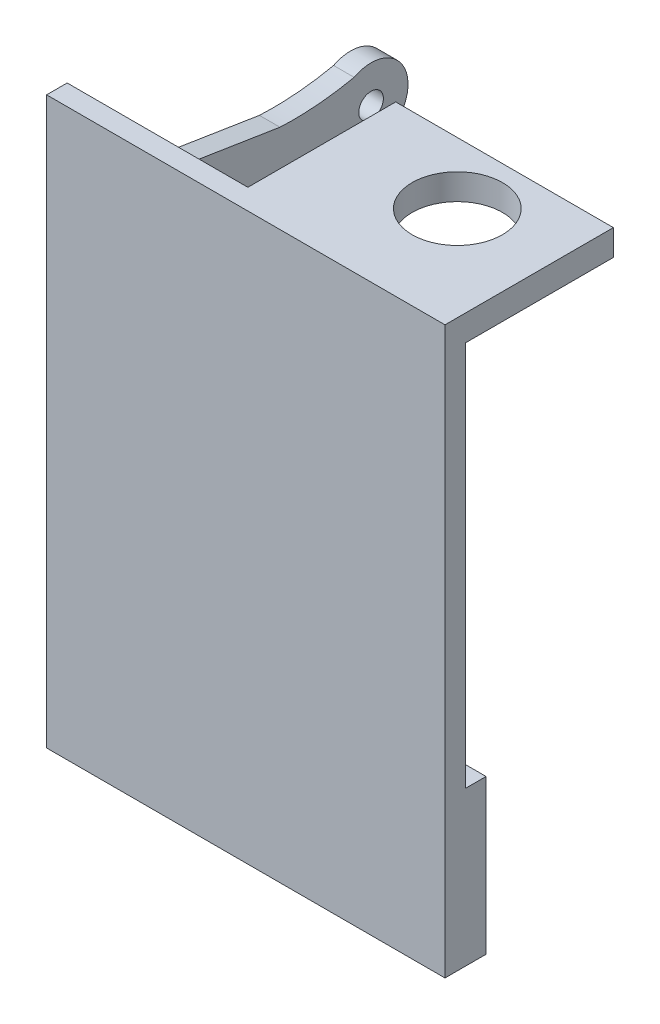
from build123d import *

# Parameters (mm, degrees)
ESQUISSE4_W             = 47
ESQUISSE4_H             = 37.5
BOSS_EXTRU_2_DEPTH      = 10
ESQUISSE5_W             = 43
ESQUISSE5_H             = 33.5
ENL_V_MAT_EXTRU_1_DEPTH = 8
ESQUISSE6_W             = 47
ESQUISSE6_H             = 5
BOSS_EXTRU_3_DEPTH      = 137.74
ESQUISSE7_W             = 5
ESQUISSE7_H             = 137.74
BOSS_EXTRU_4_DEPTH      = 50
ESQUISSE8_W             = 53
ESQUISSE8_H             = 6.3
BOSS_EXTRU_5_DEPTH      = 36
ESQUISSE9_R             = 11
ENL_V_MAT_EXTRU_4_DEPTH = 19
ESQUISSE11_W            = 5
ESQUISSE11_H            = 73.5
BOSS_EXTRU_6_DEPTH      = 80
ESQUISSE12_R            = 3
ENL_V_MAT_EXTRU_5_DEPTH = 70
ENL_V_MAT_EXTRU_6_DEPTH = 10


with BuildPart() as part:
    # Esquisse4 → Boss.-Extru.2 (new body)
    with BuildSketch(Plane.XY):
        Rectangle(ESQUISSE4_W, ESQUISSE4_H)
    extrude(amount=BOSS_EXTRU_2_DEPTH)

    # Esquisse5 → Enlèv. mat.-Extru.1 (cut)
    with BuildSketch(Plane(origin=(0, 0, 0), x_dir=(-1, 0, 0), z_dir=(0, 0, -1))):
        Rectangle(ESQUISSE5_W, ESQUISSE5_H)
    extrude(amount=-ENL_V_MAT_EXTRU_1_DEPTH, mode=Mode.SUBTRACT)

    # Esquisse6 → Boss.-Extru.3 (add)
    with BuildSketch(Plane(origin=(0, -18.75, 0), x_dir=(-1, 0, 0), z_dir=(0, -1, 0))):
        with Locations((0, -7.5)):
            Rectangle(ESQUISSE6_W, ESQUISSE6_H)
    extrude(amount=-BOSS_EXTRU_3_DEPTH)

    # Esquisse7 → Boss.-Extru.4 (add)
    with BuildSketch(Plane.ZY.offset(23.5)):
        with Locations((7.5, 50.12)):
            Rectangle(ESQUISSE7_W, ESQUISSE7_H)
    extrude(amount=BOSS_EXTRU_4_DEPTH)

    # Esquisse8 → Boss.-Extru.5 (add)
    with BuildSketch(Plane(origin=(0, 0, 5), x_dir=(-1, 0, 0), z_dir=(0, 0, -1))):
        with Locations((3, 115.84)):
            Rectangle(ESQUISSE8_W, ESQUISSE8_H)
    extrude(amount=BOSS_EXTRU_5_DEPTH)

    # Esquisse9 → Enlèv. mat.-Extru.4 (cut)
    with BuildSketch(Plane(origin=(0, 118.99, 0), x_dir=(1, 0, 0), z_dir=(0, 1, 0))):
        with Locations((0.5, 16)):
            Circle(ESQUISSE9_R)
    extrude(amount=-ENL_V_MAT_EXTRU_4_DEPTH, mode=Mode.SUBTRACT)

    # Esquisse11 → Boss.-Extru.6 (add)
    with BuildSketch(Plane(origin=(0, 0, 5), x_dir=(-1, 0, 0), z_dir=(0, 0, -1))):
        with Locations((71, 82.24)):
            Rectangle(ESQUISSE11_W, ESQUISSE11_H)
    extrude(amount=BOSS_EXTRU_6_DEPTH)

    # Esquisse12 → Enlèv. mat.-Extru.5 (cut)
    with BuildSketch(Plane.ZY.offset(73.5)):
        with Locations((-64, 82.24)):
            Circle(ESQUISSE12_R)
    extrude(amount=-ENL_V_MAT_EXTRU_5_DEPTH, mode=Mode.SUBTRACT)

    # Esquisse16 → Enlèv. mat.-Extru.6 (cut)
    with BuildSketch(Plane.ZY.offset(73.5)):
        with BuildLine():
            ThreePointArc((-58.723095017, 74.949302242), (-72.974362113, 81.561159329), (-59.879831801, 90.241513233))
            add(Edge.make_bspline(
                [(-59.879831801, 90.241513233), (-50.818298832, 88.313598128), (-41.810620551, 88.758588553)],
                knots=[0.11087403, 0.11087403, 0.11087403, 0.598896321, 0.598896321, 0.598896321], degree=2))
            Line((-41.810620551, 88.758588553), (5, 96.156828985))
            Line((5, 96.156828985), (5, 118.99))
            Line((5, 118.99), (-75, 118.99))
            Line((-75, 118.99), (-75, 45.49))
            Line((-75, 45.49), (5, 45.49))
            Line((5, 45.49), (5, 72.297743531))
            Line((5, 72.297743531), (-41.810620551, 77.009298513))
            add(Edge.make_bspline(
                [(-58.723095017, 74.949302242), (-50.298729199, 76.998586412), (-41.810620551, 77.009298513)],
                knots=[0.15923368, 0.15923368, 0.15923368, 0.613367162, 0.613367162, 0.613367162], degree=2))
        make_face()
    extrude(amount=-ENL_V_MAT_EXTRU_6_DEPTH, mode=Mode.SUBTRACT)


solid = part.part
